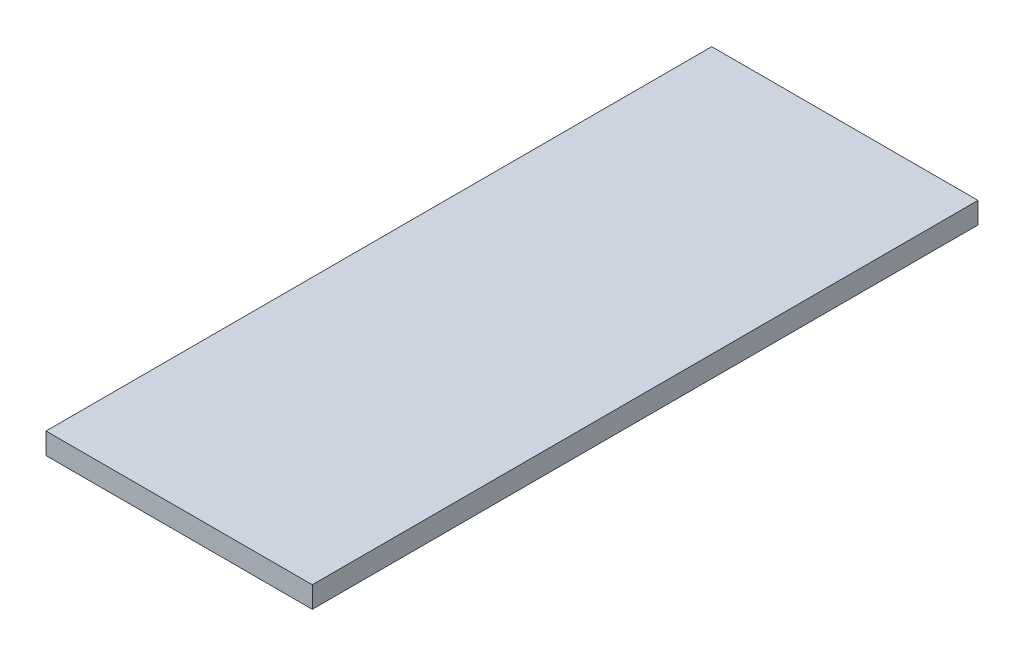
from build123d import *

# Parameters (mm, degrees)
SKETCH1_W       = 20
SKETCH1_H       = 50
PCB_BOARD_DEPTH = 1.6


with BuildPart() as part:
    # Sketch1 → pcb_board (new body)
    with BuildSketch(Plane(origin=(0, 0, 0), x_dir=(1, 0, 0), z_dir=(0, 1, 0))):
        with Locations((10, 25)):
            Rectangle(SKETCH1_W, SKETCH1_H)
    extrude(amount=PCB_BOARD_DEPTH)


solid = part.part
